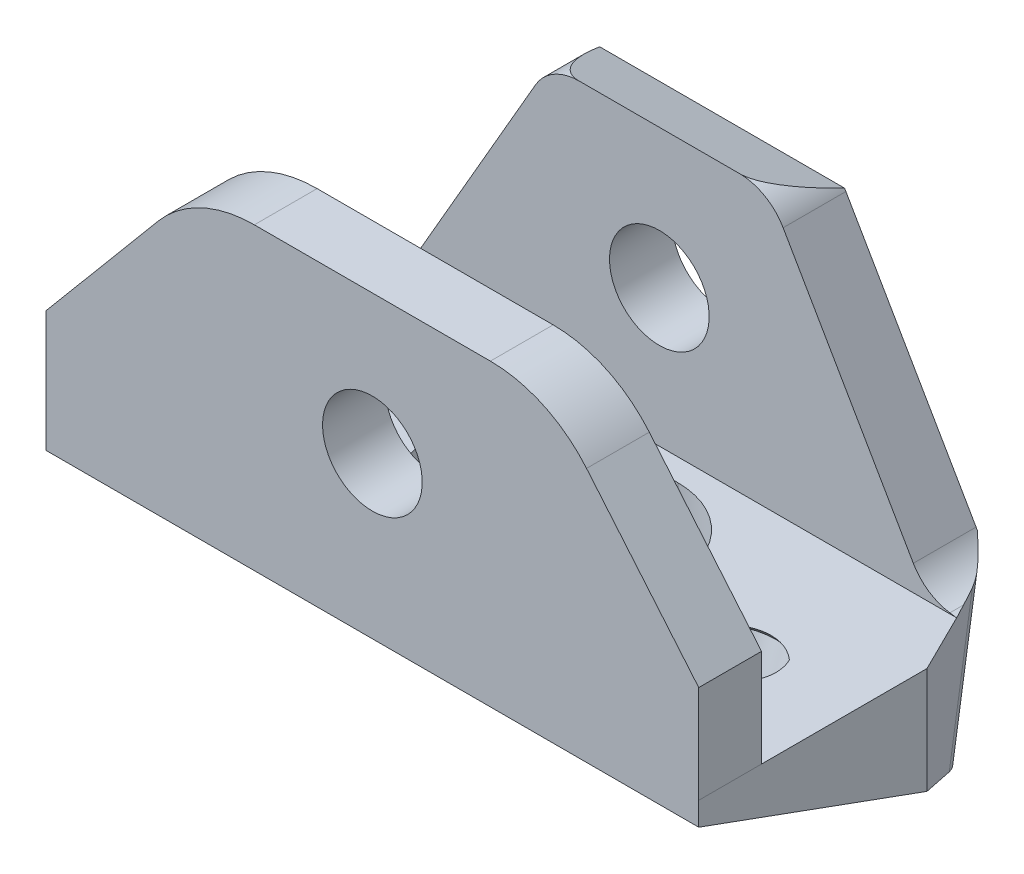
from build123d import *

# Parameters (mm, degrees)
BOSS_EXTRUDE1_DEPTH             = 43.18
CUT_EXTRUDE1_DEPTH              = 27.94
SKETCH6_W                       = 92.402659054
SKETCH6_H                       = 40.294164386
CUT_EXTRUDE3_DEPTH              = 25.4
TAP_DRILL_FOR_M8X1_0_TAP1_D     = 7
TAP_DRILL_FOR_M8X1_0_TAP1_DEPTH = 8.001
TAP_DRILL_FOR_M8X1_0_TAP1_TIP   = 2.103012167
CUT_EXTRUDE4_DEPTH              = 12.7
CUT_EXTRUDE5_DEPTH              = 15.24
F_3_8_CLEARANCE_HOLE1_D         = 10.0838
F_3_8_CLEARANCE_HOLE1_DEPTH     = 35.941
F_3_8_CLEARANCE_HOLE1_TIP       = 3.029479155
CUT_EXTRUDE6_DEPTH              = 15.24
CUT_EXTRUDE7_DEPTH              = 15.24
FILLET2_R                       = 12.7
FILLET3_R                       = 5.08
FILLET5_R                       = 5.08
FILLET4_R                       = 12.7
SKETCH16_W                      = 36.875028965
SKETCH16_H                      = 42.723051179
CUT_EXTRUDE8_DEPTH              = 12.7
SKETCH18_W                      = 36.753195168
SKETCH18_H                      = 42.885496241
CUT_EXTRUDE9_DEPTH              = 12.7
CUT_EXTRUDE10_DEPTH             = 65.85933151
CUT_EXTRUDE10_DEPTH_BACK        = 65.85933151


with BuildPart() as part:
    # Sketch1 → Boss-Extrude1 (new body)
    with BuildSketch(Plane(origin=(0, 0, 0), x_dir=(1, 0, 0), z_dir=(0, 1, 0))):
        Polygon((-26.9367, 35.3822), (26.9367, 35.3822), (44.45, 0), (-44.45, 0), align=None)
    extrude(amount=BOSS_EXTRUDE1_DEPTH)

    # Sketch3 → Cut-Extrude1 (cut)
    with BuildSketch(Plane(origin=(0, 43.18, 0), x_dir=(1, 0, 0), z_dir=(0, 1, 0))):
        Polygon((-30.079790452, 29.0322), (30.079790452, 29.0322), (41.306909548, 6.35), (-41.306909548, 6.35), align=None)
    extrude(amount=-CUT_EXTRUDE1_DEPTH, mode=Mode.SUBTRACT)

    # Sketch6 → Cut-Extrude3 (cut)
    with BuildSketch(Plane(origin=(0, 11.371619882, -4.138931152), x_dir=(-1, 0, 0), z_dir=(0, -0.939692620785908, 0.34202014332566977))):
        with Locations((0.08638911, 14.200910291)):
            Rectangle(SKETCH6_W, SKETCH6_H)
    extrude(amount=CUT_EXTRUDE3_DEPTH, mode=Mode.SUBTRACT)

    # Tap Drill for M8x1.0 Tap1
    with Locations(Plane(origin=(0, 11.371619882, -4.138931152), x_dir=(-1, 0, 0), z_dir=(0, -0.939692620785908, 0.3420201433256697))):
        with Locations((22.225, 8.988861466), (-22.225, 8.988861466)):
            Hole(TAP_DRILL_FOR_M8X1_0_TAP1_D / 2, depth=TAP_DRILL_FOR_M8X1_0_TAP1_DEPTH)
            with Locations((0, 0, -(TAP_DRILL_FOR_M8X1_0_TAP1_DEPTH + TAP_DRILL_FOR_M8X1_0_TAP1_TIP / 2))):  # 118° drill point
                Cone(0, TAP_DRILL_FOR_M8X1_0_TAP1_D / 2, TAP_DRILL_FOR_M8X1_0_TAP1_TIP, mode=Mode.SUBTRACT)

    # Sketch10 → Cut-Extrude4 (cut)
    with BuildSketch(Plane(origin=(0, 15.24, -4.821030939), x_dir=(1, 0, 0), z_dir=(0, -1, 0))):
        with BuildLine():
            Line((-4.1275, -5.440569061), (4.1275, -5.440569061))
            ThreePointArc((4.1275, -5.440569061), (12.3825, -13.695569061), (4.1275, -21.950569061))
            Line((4.1275, -21.950569061), (-4.1275, -21.950569061))
            ThreePointArc((-4.1275, -21.950569061), (-12.3825, -13.695569061), (-4.1275, -5.440569061))
        make_face()
    extrude(amount=CUT_EXTRUDE4_DEPTH, mode=Mode.SUBTRACT)

    # Sketch11 → Cut-Extrude5 (cut)
    with BuildSketch(Plane(origin=(0, 11.371619882, -4.138931152), x_dir=(1, 0, 0), z_dir=(0, -0.939692620785908, 0.3420201433256697))):
        Polygon((-26.9367, -33.248392247), (26.9367, -33.248392247), (29.430898409, -27.885957416), (-29.430898409, -27.885957416), align=None)
    extrude(amount=-CUT_EXTRUDE5_DEPTH, mode=Mode.SUBTRACT)

    # 3/8 Clearance Hole1
    with Locations(Plane(origin=(0, 0, -35.3822), x_dir=(-1, 0, 0), z_dir=(0, 0, -1))):
        with Locations((0, 29.1084)):
            Hole(F_3_8_CLEARANCE_HOLE1_D / 2, depth=F_3_8_CLEARANCE_HOLE1_DEPTH)
            with Locations((0, 0, -(F_3_8_CLEARANCE_HOLE1_DEPTH + F_3_8_CLEARANCE_HOLE1_TIP / 2))):  # 118° drill point
                Cone(0, F_3_8_CLEARANCE_HOLE1_D / 2, F_3_8_CLEARANCE_HOLE1_TIP, mode=Mode.SUBTRACT)

    # Sketch14 → Cut-Extrude6 (cut)
    with BuildSketch(Plane(origin=(0, 0, -35.3822), x_dir=(-1, 0, 0), z_dir=(0, 0, -1))):
        Polygon((-26.9367, 15.678710556), (-11.058823136, 43.18), (-30.079790452, 43.18), (-30.079790452, 15.24), align=None)
        Polygon((26.9367, 15.678710556), (11.058823136, 43.18), (30.079790452, 43.18), (30.079790452, 15.24), align=None)
    extrude(amount=-CUT_EXTRUDE6_DEPTH, mode=Mode.SUBTRACT)

    # Sketch15 → Cut-Extrude7 (cut)
    with BuildSketch(Plane(origin=(0, 0, -6.35), x_dir=(-1, 0, 0), z_dir=(0, 0, -1))):
        Polygon((-41.306909548, 15.24), (-17.862465853, 43.18), (-44.45, 43.18), (-44.45, 12.878067623), align=None)
        Polygon((41.306909548, 15.24), (17.862465853, 43.18), (44.45, 43.18), (44.45, 12.878067623), align=None)
    extrude(amount=-CUT_EXTRUDE7_DEPTH, mode=Mode.SUBTRACT)

    # Fillet2
    # the kernel refuses this fillet: 12.7 mm, written as the material it adds along each edge
    with BuildSketch(Plane(origin=(41.306909548, 15.24, -6.35), x_dir=(0.7994362738246867, -0.6007509002018228, 0), z_dir=(0, 0, 1))) as fillet2_piece_1_section:
        with BuildLine():
            CenterArc((FILLET2_R * 0.114610182793, FILLET2_R), FILLET2_R, 256.923695862, 13.076304138)
            Line((-FILLET2_R * 0.111638297241, FILLET2_R * 0.0259303796532), (0, 0))
            Line((0, 0), (FILLET2_R * 0.114610182793, 0))
        make_face()
    fillet2_piece_1 = extrude(amount=6.35, mode=Mode.PRIVATE)
    fillet2_piece_1 = split(fillet2_piece_1, bisect_by=Plane(origin=(42.634214794, 15.269843294, -3.668439147), z_dir=(-0.8962213844521023, 0, 0.4436070671785529)), keep=Keep.TOP, mode=Mode.PRIVATE)
    add(fillet2_piece_1)
    with BuildSketch(Plane(origin=(-41.306909548, 15.24, -6.35), x_dir=(-0.7994362738246867, -0.6007509002018229, 0), z_dir=(0, 0, 1))) as fillet2_piece_2_section:
        with BuildLine():
            CenterArc((FILLET2_R * 0.114610182793, -FILLET2_R), FILLET2_R, 90, 13.076304138)
            Line((-FILLET2_R * 0.111638297241, -FILLET2_R * 0.0259303796532), (0, 0))
            Line((0, 0), (FILLET2_R * 0.114610182793, 0))
        make_face()
    fillet2_piece_2 = extrude(amount=6.35, mode=Mode.PRIVATE)
    fillet2_piece_2 = split(fillet2_piece_2, bisect_by=Plane(origin=(-42.634214794, 15.269843294, -3.668439147), z_dir=(0.8962213844521023, 0, 0.4436070671785529)), keep=Keep.TOP, mode=Mode.PRIVATE)
    add(fillet2_piece_2)
    # the kernel refuses this fillet: 12.7 mm, written as the material it takes off along each edge
    with BuildSketch(Plane(origin=(17.862465853, 43.18, -21.155268146), x_dir=(-1, 0, 0), z_dir=(0, 0, 1)), Plane(origin=(-17.862465853, 43.18, -21.155268146), x_dir=(-0.6427876096865353, -0.7660444431189815, 0), z_dir=(0, 0, 1))) as fillet2_2_piece_1:
        with BuildLine():
            CenterArc((FILLET2_R * 0.466307658155, FILLET2_R), FILLET2_R, 220, 50)
            Line((-FILLET2_R * 0.299736784964, FILLET2_R * 0.357212390313), (0, 0))
            Line((0, 0), (FILLET2_R * 0.466307658155, 0))
        make_face()
    extrude(amount=35.960536293, mode=Mode.SUBTRACT)

    # Fillet3
    # the kernel refuses this fillet: 5.08 mm, written as the material it adds along each edge
    with BuildSketch(Plane(origin=(26.9367, 15.678710556, -35.3822), x_dir=(0.9903988653234791, -0.1382392403262007, 0), z_dir=(0, 0, 1))) as fillet3_piece_1_section:
        with BuildLine():
            CenterArc((FILLET3_R * 0.488316369793, FILLET3_R), FILLET3_R, 217.945971462, 52.054028538)
            Line((-FILLET3_R * 0.300274587293, FILLET3_R * 0.385081873416), (0, 0))
            Line((0, 0), (FILLET3_R * 0.488316369793, 0))
        make_face()
    fillet3_piece_1 = extrude(amount=6.35, mode=Mode.PRIVATE)
    fillet3_piece_1 = split(fillet3_piece_1, bisect_by=Plane(origin=(28.34322893, 16.154895704, -32.540583178), z_dir=(-0.8962213844519045, 0, 0.4436070671789527)), keep=Keep.TOP, mode=Mode.PRIVATE)
    add(fillet3_piece_1)
    with BuildSketch(Plane(origin=(-26.9367, 15.678710556, -35.3822), x_dir=(-0.9903988653234792, -0.13823924032619928, 0), z_dir=(0, 0, 1))) as fillet3_piece_2_section:
        with BuildLine():
            CenterArc((FILLET3_R * 0.488316369793, -FILLET3_R), FILLET3_R, 90, 52.054028538)
            Line((-FILLET3_R * 0.300274587293, -FILLET3_R * 0.385081873416), (0, 0))
            Line((0, 0), (FILLET3_R * 0.488316369793, 0))
        make_face()
    fillet3_piece_2 = extrude(amount=6.35, mode=Mode.PRIVATE)
    fillet3_piece_2 = split(fillet3_piece_2, bisect_by=Plane(origin=(-28.34322893, 16.154895704, -32.540583178), z_dir=(0.8962213844519045, 0, 0.4436070671789527)), keep=Keep.TOP, mode=Mode.PRIVATE)
    add(fillet3_piece_2)
    # the kernel refuses this fillet: 5.08 mm, written as the material it takes off along each edge
    with BuildSketch(Plane(origin=(11.058823136, 43.18, -42.714548419), x_dir=(0.49999999999999484, -0.8660254037844416, 0), z_dir=(0, 0, 1)), Plane(origin=(-11.058823136, 43.18, -42.714548419), x_dir=(1, 0, 0), z_dir=(0, 0, 1))) as fillet3_2_piece_1:
        with BuildLine():
            CenterArc((FILLET3_R * 0.57735026919, -FILLET3_R), FILLET3_R, 90, 60)
            Line((-FILLET3_R * 0.288675134595, -FILLET3_R * 0.5), (0, 0))
            Line((0, 0), (FILLET3_R * 0.57735026919, 0))
        make_face()
    extrude(amount=21.014696837, mode=Mode.SUBTRACT)

    # Fillet5
    fillet5_edges = [part.edges().sort_by_distance(p)[0] for p in [
        (28.183799204, 8.756385643, -32.86267978),
        (-28.183799204, 8.756385643, -32.86267978),
    ]]
    fillet(fillet5_edges, radius=FILLET5_R)

    # Fillet4
    # the kernel refuses this fillet: 12.7 mm, written as the material it takes off along each edge
    with BuildSketch(Plane(origin=(-29.229670418, 15.678710556, -35.3822), x_dir=(0, 1, 0), z_dir=(1, 0, 0))) as fillet4_piece_1:
        with BuildLine():
            CenterArc((FILLET4_R * 0.176326980708, FILLET4_R), FILLET4_R, 250, 20)
            Line((-FILLET4_R * 0.165693162617, FILLET4_R * 0.0603073792141), (0, 0))
            Line((0, 0), (FILLET4_R * 0.176326980708, 0))
        make_face()
    extrude(amount=58.459340836, mode=Mode.SUBTRACT)

    # Sketch16 → Cut-Extrude8 (cut)
    with BuildSketch(Plane(origin=(-45.72, 0, 0), x_dir=(0, 0, -1), z_dir=(1, 0, 0))):
        with Locations((17.528654939, 22.385196569)):
            Rectangle(SKETCH16_W, SKETCH16_H)
    extrude(amount=CUT_EXTRUDE8_DEPTH, mode=Mode.SUBTRACT)

    # Sketch18 → Cut-Extrude9 (cut)
    with BuildSketch(Plane.ZY.offset(-45.72)):
        with Locations((-17.752016898, 22.669475427)):
            Rectangle(SKETCH18_W, SKETCH18_H)
    extrude(amount=CUT_EXTRUDE9_DEPTH, mode=Mode.SUBTRACT)

    # Sketch19 → Cut-Extrude10 (cut, two sides: drawn at the far end of the back side and taken through both)
    with BuildSketch(Plane(origin=(0, 0, 0), x_dir=(0, 0, -1), z_dir=(1, 0, 0)).offset(-CUT_EXTRUDE10_DEPTH_BACK)):
        Polygon((29.0322, 43.18), (35.3822, 40.868789012), (35.3822, 43.18), align=None)
    extrude(amount=CUT_EXTRUDE10_DEPTH + CUT_EXTRUDE10_DEPTH_BACK, mode=Mode.SUBTRACT)


solid = part.part
